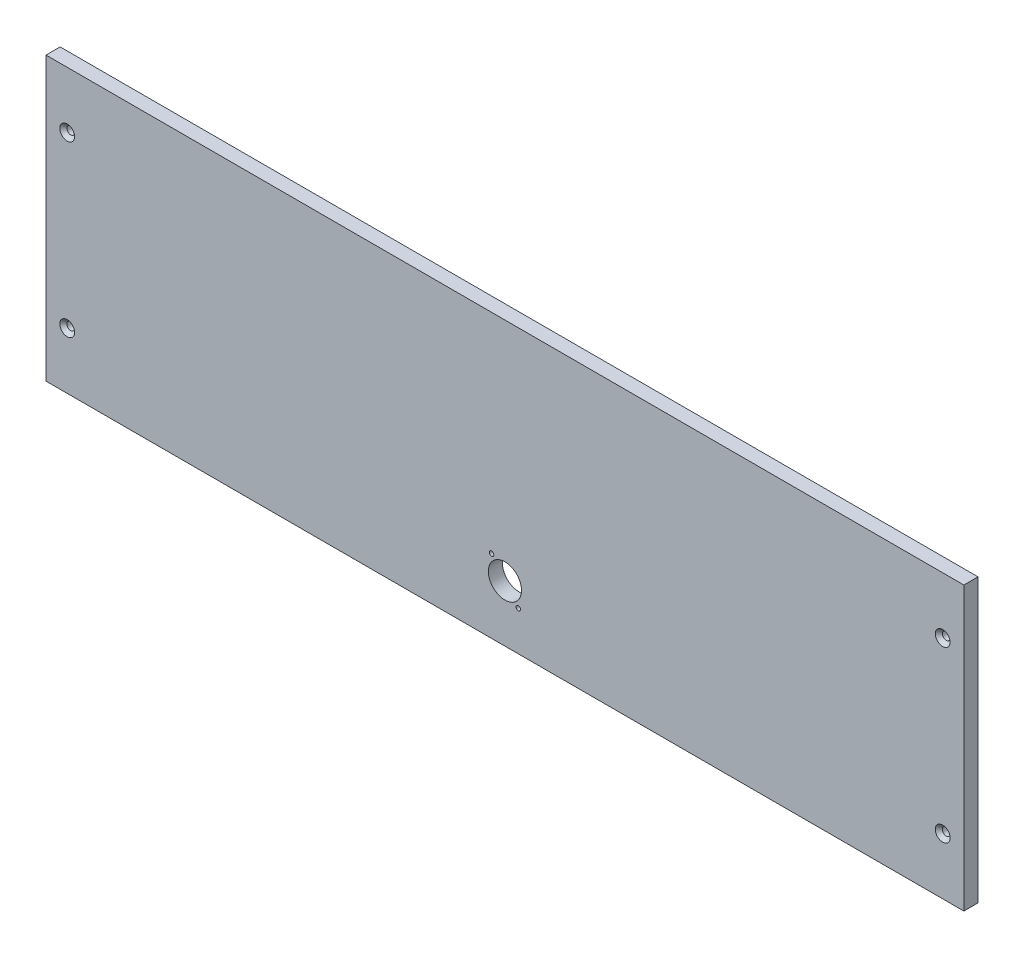
from build123d import *

# Parameters (mm, degrees)
ESQUISSE1_W             = 650
ESQUISSE1_H             = 200
BOSS_EXTRU_1_DEPTH      = 10
ESQUISSE2_R             = 2.75
ENL_V_MAT_EXTRU_1_DEPTH = 10
CHANFREIN1_SIZE         = 2.5
ESQUISSE3_R             = 1.6
ESQUISSE3_R_2           = 11.75
ENL_V_MAT_EXTRU_2_DEPTH = 10


with BuildPart() as part:
    # Esquisse1 → Boss.-Extru.1 (new body)
    with BuildSketch(Plane.XY):
        with Locations((325, 100)):
            Rectangle(ESQUISSE1_W, ESQUISSE1_H)
    extrude(amount=BOSS_EXTRU_1_DEPTH)

    # Esquisse2 → Enlèv. mat.-Extru.1 (cut)
    with BuildSketch(Plane.XY.offset(10)):
        with Locations((15, 160)):
            Circle(ESQUISSE2_R)
        with Locations((635, 160)):
            Circle(ESQUISSE2_R)
        with Locations((15, 40)):
            Circle(ESQUISSE2_R)
        with Locations((635, 40)):
            Circle(ESQUISSE2_R)
    extrude(amount=-ENL_V_MAT_EXTRU_1_DEPTH, mode=Mode.SUBTRACT)

    # Chanfrein1
    chanfrein1_edges = [part.edges().sort_by_distance(p)[0] for p in [
        (12.25, 160, 10),
        (12.25, 40, 10),
        (632.25, 40, 10),
        (632.25, 160, 10),
    ]]
    chamfer(chanfrein1_edges, length=CHANFREIN1_SIZE)

    # Esquisse3 → Enlèv. mat.-Extru.2 (cut)
    with BuildSketch(Plane.XY.offset(10)):
        with Locations((315.499614794, 51.999404399)):
            Circle(ESQUISSE3_R)
        with Locations((325, 40)):
            Circle(ESQUISSE3_R_2)
        with Locations((334.500385206, 28.000595601)):
            Circle(ESQUISSE3_R)
    extrude(amount=-ENL_V_MAT_EXTRU_2_DEPTH, mode=Mode.SUBTRACT)


solid = part.part
